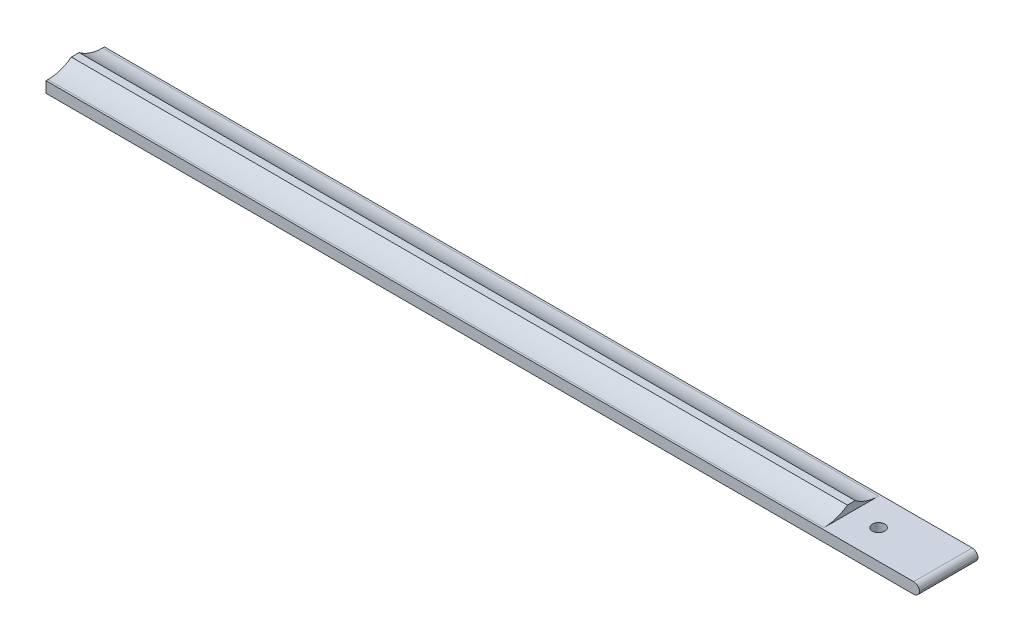
from build123d import *

# Parameters (mm, degrees)
SKETCH1_W           = 224
SKETCH1_H           = 15
BOSS_EXTRUDE1_DEPTH = 2.8
SKETCH2_W           = 199
SKETCH2_H           = 2
BOSS_EXTRUDE2_DEPTH = 2
SKETCH3_R           = 1.6
CUT_EXTRUDE1_DEPTH  = 113.285751545
FILLET1_R           = 10
FILLET2_R           = 1.5


with BuildPart() as part:
    # Sketch1 → Boss-Extrude1 (new body)
    with BuildSketch(Plane(origin=(0, 0, 0), x_dir=(1, 0, 0), z_dir=(0, 1, 0))):
        Rectangle(SKETCH1_W, SKETCH1_H)
    extrude(amount=BOSS_EXTRUDE1_DEPTH)

    # Sketch2 → Boss-Extrude2 (add)
    with BuildSketch(Plane(origin=(0, 2.8, 0), x_dir=(1, 0, 0), z_dir=(0, 1, 0))):
        with Locations((-12.5, 0)):
            Rectangle(SKETCH2_W, SKETCH2_H)
    extrude(amount=BOSS_EXTRUDE2_DEPTH)

    # Sketch3 → Cut-Extrude1 (cut, through all)
    with BuildSketch(Plane(origin=(0, 2.8, 0), x_dir=(1, 0, 0), z_dir=(0, 1, 0))):
        with Locations(Location((94, 0, 0), (0, 0, 270))):
            Circle(SKETCH3_R)
    extrude(amount=-CUT_EXTRUDE1_DEPTH, mode=Mode.SUBTRACT)

    # Fillet1
    # the kernel refuses this fillet: 10 mm, written as the material it adds along each edge
    with BuildSketch(Plane(origin=(-112, 2.8, -1), x_dir=(0, 0, -1), z_dir=(1, 0, 0)), Plane(origin=(87, 2.8, 1), x_dir=(0, 0, 1), z_dir=(-1, 0, 0))) as fillet1_piece_1:
        with BuildLine():
            CenterArc((6, 10), FILLET1_R, 233.130102354, 36.869897646)
            Line((0, 2), (0, 0))
            Line((0, 0), (6, 0))
        make_face()
    extrude(amount=199)

    # Fillet2
    # the kernel refuses this fillet: 1.5 mm, written as the material it takes off along each edge
    with BuildSketch(Plane(origin=(112, 0, -11.25), x_dir=(0, 1, 0), z_dir=(0, 0, 1))) as fillet2_piece_1:
        with BuildLine():
            CenterArc((FILLET2_R, FILLET2_R), FILLET2_R, 180, 90)
            Line((0, FILLET2_R), (0, 0))
            Line((0, 0), (FILLET2_R, 0))
        make_face()
    extrude(amount=22.5, mode=Mode.SUBTRACT)
    with BuildSketch(Plane(origin=(112, 2.8, -11.25), x_dir=(0, -1, 0), z_dir=(0, 0, 1))) as fillet2_piece_2:
        with BuildLine():
            CenterArc((FILLET2_R, -FILLET2_R), FILLET2_R, 90, 90)
            Line((0, -FILLET2_R), (0, 0))
            Line((0, 0), (FILLET2_R, 0))
        make_face()
    extrude(amount=22.5, mode=Mode.SUBTRACT)


solid = part.part
